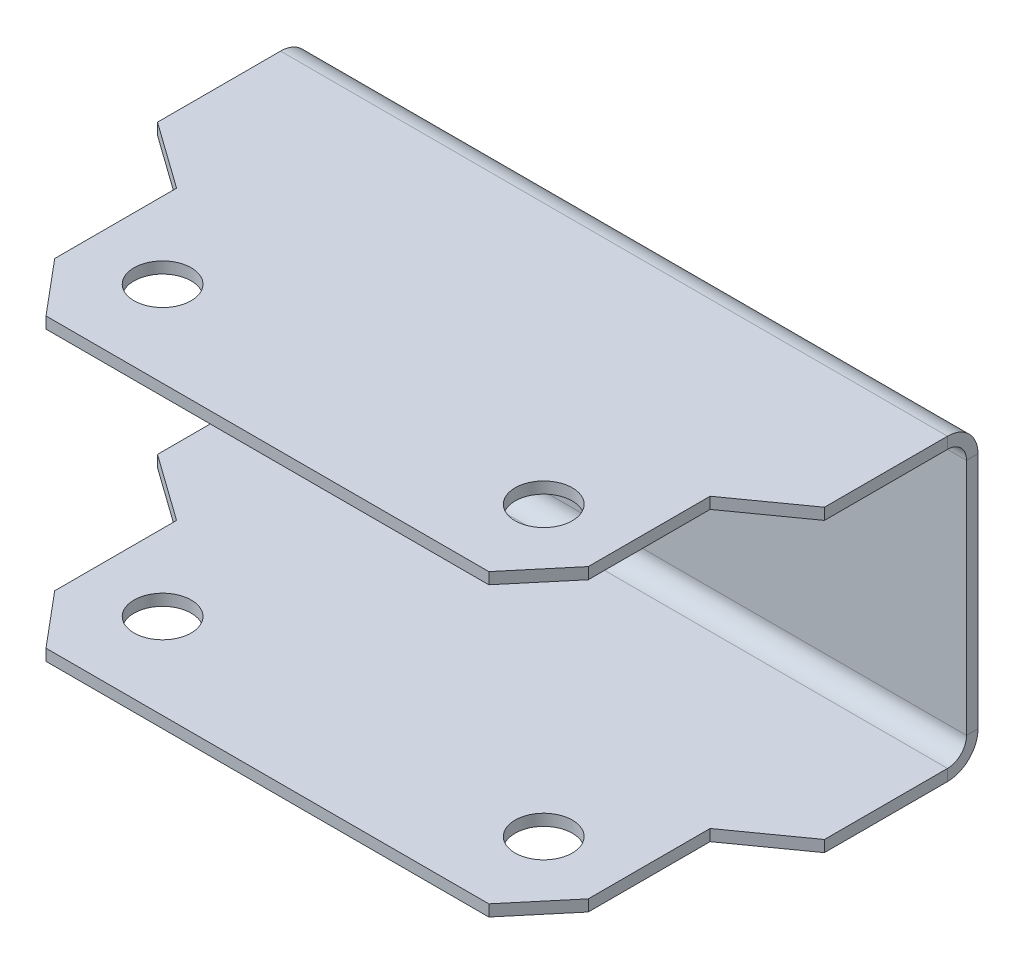
from build123d import *

# Parameters (mm, degrees)
SM_BASE_FLANGE_1_DEPTH = 1.2
SKETCH_5_R             = 3
CUT_EXTRUDE_1_DEPTH    = 64.494960298
OTHER_START            = 15.362016
OTHER_1_OUTLINE_W      = 70
OTHER_1_OUTLINE_H      = 1.2
OTHER_1_DEPTH          = 37.601839442
OTHER_START_2          = -52.963855442
OTHER_1_2_OUTLINE_W    = 70
OTHER_1_2_OUTLINE_H    = 1.2
OTHER_1_2_DEPTH        = 37.565871442
OTHER_START_3          = -15.7
OTHER_1_3_OUTLINE_R    = 3
OTHER_1_3_DEPTH        = 3.2
OTHER_START_4          = 12.5
OTHER_1_4_OUTLINE_R    = 3
OTHER_1_4_DEPTH        = 3.2
OTHER_START_5          = -35
OTHER_1_5_DEPTH        = 70


with BuildPart() as part:
    # 基体-法兰1: sheet metal written as solids
    # Sketch 1 → 基体-法兰1 (new body)
    with BuildSketch(Plane.XY):
        Polygon((35, 29.5), (28, 34.498419782), (28, 47.289071522), (23.238290906, 52.963855442), (-23.238290906, 52.963855442), (-28, 47.289071522), (-28, 34.498419782), (-35, 29.5), (-35, -29.5), (-28, -34.498419782), (-28, -47.289071522), (-23.238290906, -52.963855442), (23.238290906, -52.963855442), (28, -47.289071522), (28, -34.498419782), (35, -29.5), align=None)
    extrude(amount=-SM_BASE_FLANGE_1_DEPTH)

    # 草图5 → 切除-拉伸1 (cut, through all)
    with BuildSketch(Plane.XY):
        with Locations((-20, 43.963855442)):
            Circle(SKETCH_5_R)
        with Locations(Location((20, 43.963855442, 0), (0, 0, 180))):
            Circle(SKETCH_5_R)
        with Locations((20, -43.963855442)):
            Circle(SKETCH_5_R)
        with Locations(Location((-20, -43.963855442, 0), (0, 0, 180))):
            Circle(SKETCH_5_R)
    extrude(amount=-CUT_EXTRUDE_1_DEPTH, mode=Mode.SUBTRACT)

    # Other 1: read off the stored shape, not the designer's step
    # Other 1 outline → Other 1 (cut)
    with BuildSketch(Plane(origin=(0, 0, 0), x_dir=(1, 0, 0), z_dir=(0, 1, 0)).offset(OTHER_START)):
        with Locations((0, 0.6)):
            Rectangle(OTHER_1_OUTLINE_W, OTHER_1_OUTLINE_H)
    extrude(amount=OTHER_1_DEPTH, mode=Mode.SUBTRACT)

    # Other 1 2 outline → Other 1 2 (cut)
    with BuildSketch(Plane(origin=(0, 0, 0), x_dir=(1, 0, 0), z_dir=(0, 1, 0)).offset(OTHER_START_2)):
        with Locations((0, 0.6)):
            Rectangle(OTHER_1_2_OUTLINE_W, OTHER_1_2_OUTLINE_H)
    extrude(amount=OTHER_1_2_DEPTH, mode=Mode.SUBTRACT)

    # Other 1 3 outline → Other 1 3 (add)
    with BuildSketch(Plane(origin=(0, 0, 0), x_dir=(1, 0, 0), z_dir=(0, 1, 0)).offset(OTHER_START_3)):
        Polygon((35, 0), (-35, 0), (-35, -14.91592955), (-28, -19.914349333), (-28, -32.705001072), (-23.238290906, -38.379784993), (23.238290906, -38.379784993), (28, -32.705001072), (28, -19.914349333), (35, -14.91592955), align=None)
        with Locations((-20, -29.379784993)):
            Circle(OTHER_1_3_OUTLINE_R, mode=Mode.SUBTRACT)
        with Locations((20, -29.379784993)):
            Circle(OTHER_1_3_OUTLINE_R, mode=Mode.SUBTRACT)
    extrude(amount=OTHER_1_3_DEPTH)

    # Other 1 4 outline → Other 1 4 (add)
    with BuildSketch(Plane(origin=(0, 0, 0), x_dir=(1, 0, 0), z_dir=(0, 1, 0)).offset(OTHER_START_4)):
        Polygon((35, 0), (-35, 0), (-35, -14.91592955), (-28, -19.914349333), (-28, -32.705001072), (-23.238290906, -38.379784993), (23.238290906, -38.379784993), (28, -32.705001072), (28, -19.914349333), (35, -14.91592955), align=None)
        with Locations((-20, -29.379784993)):
            Circle(OTHER_1_4_OUTLINE_R, mode=Mode.SUBTRACT)
        with Locations((20, -29.379784993)):
            Circle(OTHER_1_4_OUTLINE_R, mode=Mode.SUBTRACT)
    extrude(amount=OTHER_1_4_DEPTH)

    # Other 1 5 outline → Other 1 5 (cut)
    with BuildSketch(Plane.YZ.offset(OTHER_START_5)):
        with BuildLine():
            Line((14.5, 2), (14.5, 38.379784993))
            Line((14.5, 38.379784993), (12.5, 38.379784993))
            Line((12.5, 38.379784993), (12.5, 0))
            ThreePointArc((12.5, 0), (13.914213562, 0.585786438), (14.5, 2))
        make_face()
        with BuildLine():
            Line((-12.5, 38.379784993), (-14.5, 38.379784993))
            Line((-14.5, 38.379784993), (-14.5, 2))
            ThreePointArc((-14.5, 2), (-13.914213562, 0.585786438), (-12.5, 0))
            Line((-12.5, 0), (-12.5, 38.379784993))
        make_face()
        with BuildLine():
            Line((-15.397984, -1.2), (-12.5, -1.2))
            ThreePointArc((-12.5, -1.2), (-14.7627417, -0.2627417), (-15.7, 2))
            Line((-15.7, 2), (-15.7, 0))
            Line((-15.7, 0), (-15.397984, 0))
            Line((-15.397984, 0), (-15.397984, -1.2))
        make_face()
        with BuildLine():
            ThreePointArc((15.7, 2), (14.7627417, -0.2627417), (12.5, -1.2))
            Line((12.5, -1.2), (15.362016, -1.2))
            Line((15.362016, -1.2), (15.362016, 0))
            Line((15.362016, 0), (15.7, 0))
            Line((15.7, 0), (15.7, 2))
        make_face()
    extrude(amount=OTHER_1_5_DEPTH, mode=Mode.SUBTRACT)


solid = part.part
